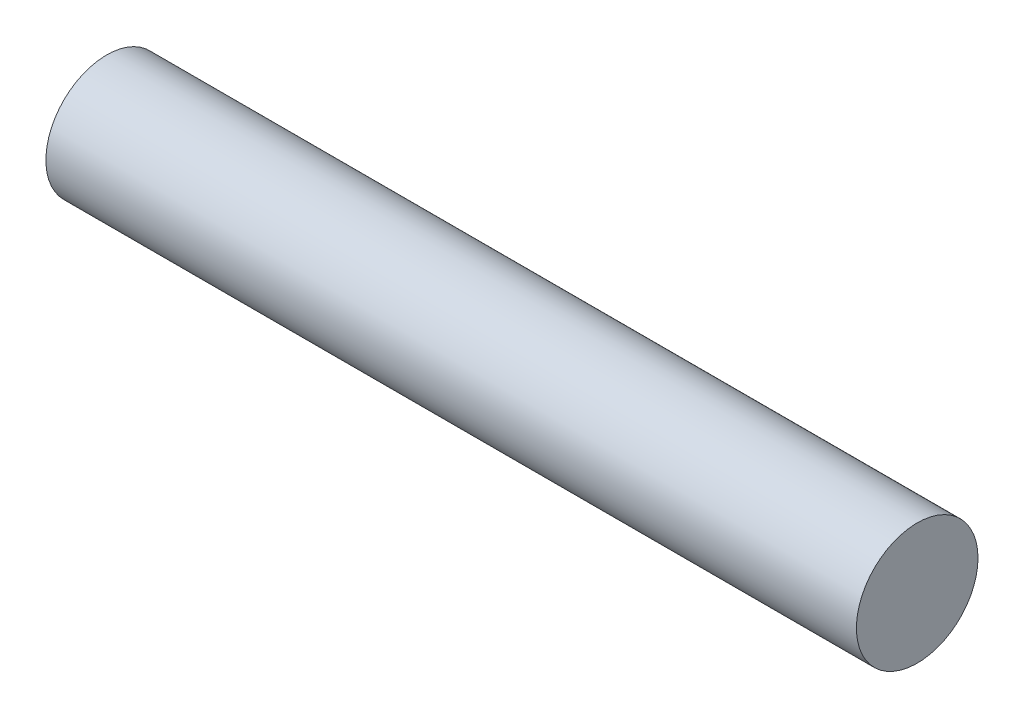
from build123d import *

# Parameters (mm, degrees)
SKETCH1_R           = 4.5
BOSS_EXTRUDE1_DEPTH = 30


with BuildPart() as part:
    # Sketch1 → Boss-Extrude1 (new, symmetric)
    with BuildSketch(Plane(origin=(0, 0, 0), x_dir=(0, 0, -1), z_dir=(1, 0, 0))):
        Circle(SKETCH1_R)
    extrude(amount=BOSS_EXTRUDE1_DEPTH, both=True)


solid = part.part
